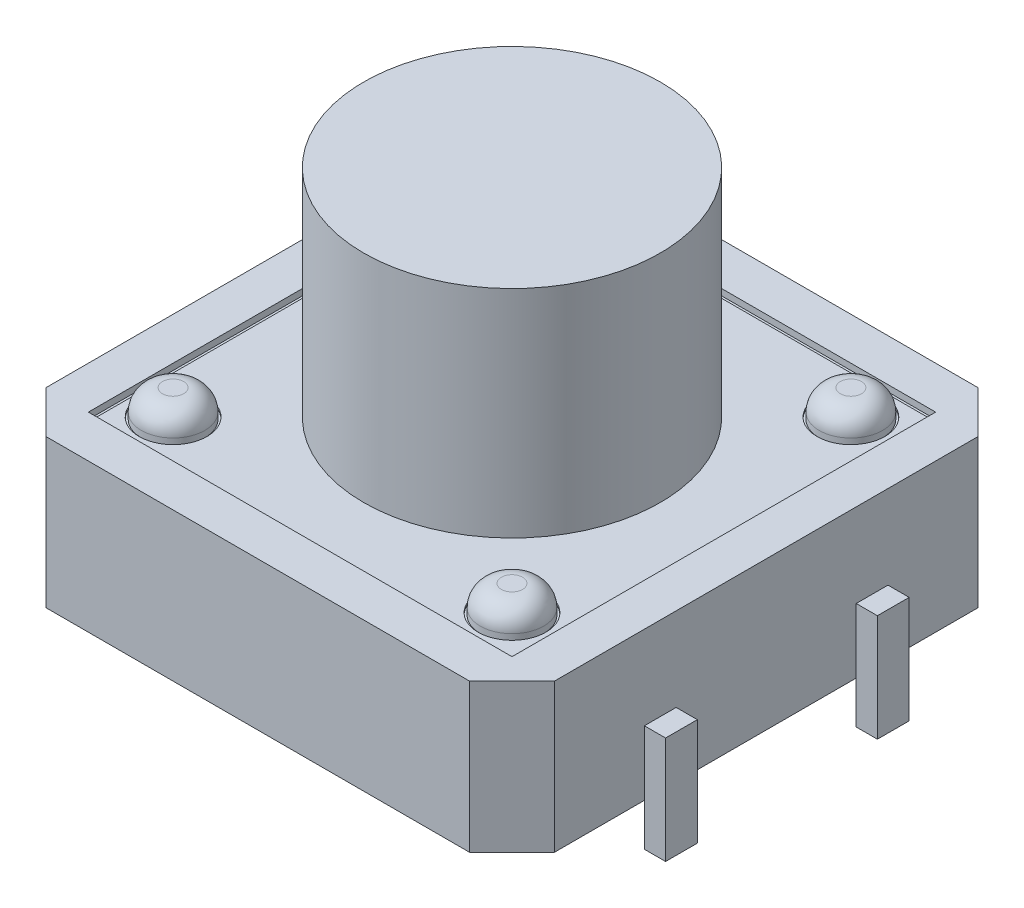
from build123d import *

# Parameters (mm, degrees)
SKETCH1_W                = 12
SKETCH1_H                = 12
BOSS_EXTRUDE1_DEPTH      = 3.5
SKETCH15_W               = 10
SKETCH15_H               = 10
CUT_EXTRUDE1_DEPTH       = 0.15
BOSS_EXTRUDE2_DEPTH      = 5
BOSS_EXTRUDE2_DEPTH_BACK = 3.5
SKETCH2_R                = 3.5
CHAMFER1_SIZE            = 1
SKETCH4_W                = 0.5
SKETCH4_H                = 2.525109238
BASE_FLANGE1_DEPTH       = 0.375
SKETCH16_R               = 0.75
BOSS_EXTRUDE3_DEPTH      = 0.65
FILLET1_R                = 0.5
SKETCH17_W               = 9.8
SKETCH17_H               = 9.8
SKETCH17_R               = 0.8
BOSS_EXTRUDE4_DEPTH      = 0.05


# Sheet-metal steps are written as plain solids
with BuildPart() as part:
    # Sketch1 → Boss-Extrude1 (new body)
    with BuildSketch(Plane(origin=(0, 0, 0), x_dir=(1, 0, 0), z_dir=(0, 1, 0))):
        Rectangle(SKETCH1_W, SKETCH1_H)
    extrude(amount=BOSS_EXTRUDE1_DEPTH)

    # Sketch15 → Cut-Extrude1 (cut)
    with BuildSketch(Plane(origin=(0, 3.5, 0), x_dir=(1, 0, 0), z_dir=(0, 1, 0))):
        Rectangle(SKETCH15_W, SKETCH15_H)
    extrude(amount=-CUT_EXTRUDE1_DEPTH, mode=Mode.SUBTRACT)

    # Sketch2 → Boss-Extrude2 (add, two sides: drawn at the far end of the back side and taken through both)
    with BuildSketch(Plane(origin=(0, 3.5, 0), x_dir=(1, 0, 0), z_dir=(0, 1, 0)).offset(-BOSS_EXTRUDE2_DEPTH_BACK)):
        with Locations(Location((0, 0, 0), (0, 0, 270))):
            Circle(SKETCH2_R)
    extrude(amount=BOSS_EXTRUDE2_DEPTH + BOSS_EXTRUDE2_DEPTH_BACK)

    # Chamfer1
    chamfer1_edges = [part.edges().sort_by_distance(p)[0] for p in [
        (6, 1.75, 6),
        (-6, 1.75, 6),
        (-6, 1.75, -6),
        (6, 1.75, -6),
    ]]
    chamfer(chamfer1_edges, length=CHAMFER1_SIZE)

    # Sketch16 → Boss-Extrude3 (add)
    with BuildSketch(Plane(origin=(0, 3.35, 0), x_dir=(1, 0, 0), z_dir=(0, 1, 0))):
        with Locations(Location((-4, 4, 0), (0, 0, 270))):
            Circle(SKETCH16_R)
        with Locations(Location((4, 4, 0), (0, 0, 90))):
            Circle(SKETCH16_R)
        with Locations(Location((4, -4, 0), (0, 0, 270))):
            Circle(SKETCH16_R)
        with Locations(Location((-4, -4, 0), (0, 0, 90))):
            Circle(SKETCH16_R)
    extrude(amount=BOSS_EXTRUDE3_DEPTH)

    # Fillet1
    fillet1_edges = [part.edges().sort_by_distance(p)[0] for p in [
        (-4, 4, -4.75),
        (4, 4, -3.25),
        (4, 4, 3.25),
        (-4, 4, 4.75),
    ]]
    fillet(fillet1_edges, radius=FILLET1_R)

    # Sketch17 → Boss-Extrude4 (add)
    with BuildSketch(Plane(origin=(0, 3.35, 0), x_dir=(1, 0, 0), z_dir=(0, 1, 0))):
        Rectangle(SKETCH17_W, SKETCH17_H)
        with Locations(Location((-4, 4, 0), (0, 0, 270))):
            Circle(SKETCH17_R, mode=Mode.SUBTRACT)
        with Locations(Location((4, 4, 0), (0, 0, 270))):
            Circle(SKETCH17_R, mode=Mode.SUBTRACT)
        with Locations(Location((-4, -4, 0), (0, 0, 270))):
            Circle(SKETCH17_R, mode=Mode.SUBTRACT)
        with Locations(Location((4, -4, 0), (0, 0, 270))):
            Circle(SKETCH17_R, mode=Mode.SUBTRACT)
    extrude(amount=BOSS_EXTRUDE4_DEPTH)


with BuildPart() as body_2:
    # Sketch4 → Base-Flange1 (new, symmetric)
    with BuildSketch(Plane.XY.offset(2.5)):
        with Locations((6.25, 0.262554619)):
            Rectangle(SKETCH4_W, SKETCH4_H)
    extrude(amount=BASE_FLANGE1_DEPTH, both=True)


with BuildPart() as body_3:
    # Mirror1: mirrored copy
    add(body_2.part.mirror(Plane.XY))


with BuildPart() as body_4:
    # Mirror2: mirrored copy
    add(body_2.part.mirror(Plane(origin=(0, 0, 0), x_dir=(0, 0, 1), z_dir=(1, 0, 0))))


with BuildPart() as body_5:
    # Mirror2 2: mirrored copy
    add(body_3.part.mirror(Plane(origin=(0, 0, 0), x_dir=(0, 0, 1), z_dir=(1, 0, 0))))


solid = Compound([part.part, body_2.part, body_3.part, body_4.part, body_5.part])
